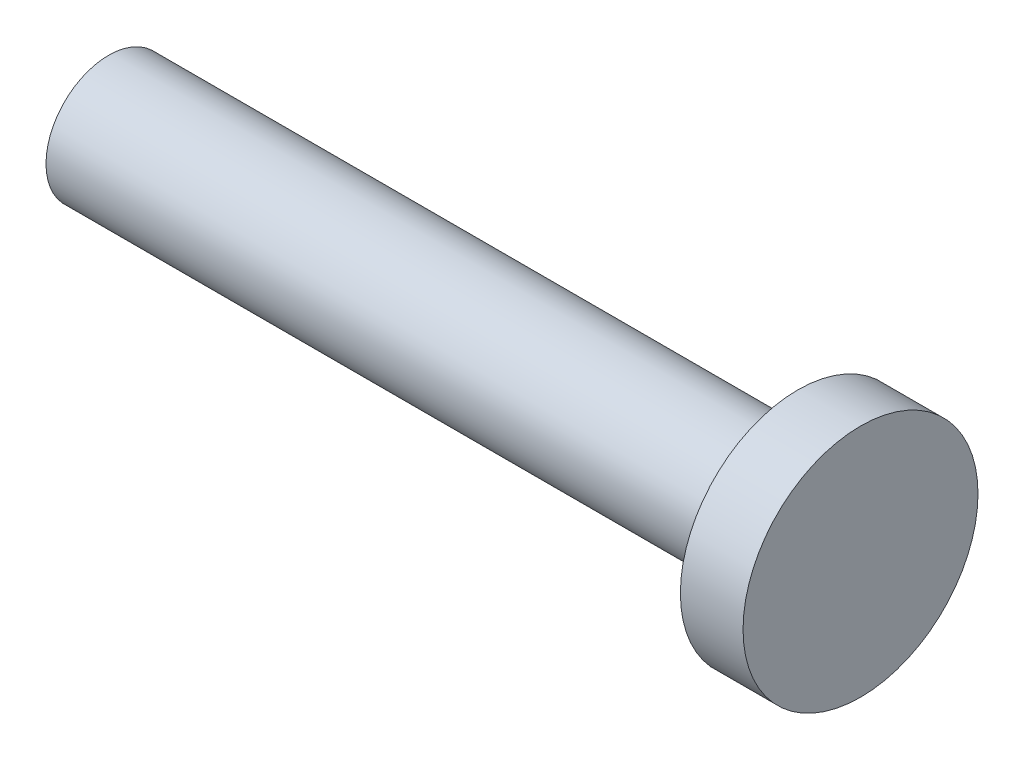
from build123d import *

# Parameters (mm, degrees)
SKETCH1_W           = 11
SKETCH1_H           = 1
SKETCH2_R           = 1.875
BOSS_EXTRUDE1_DEPTH = 1


with BuildPart() as part:
    # Sketch1 → Revolve1 (revolve)
    with BuildSketch(Plane.XY):
        with Locations((-144.727441652, 0.5)):
            Rectangle(SKETCH1_W, SKETCH1_H)
    revolve(axis=Axis((-150.227441652, 0, 0), (1, 0, 0)))

    # Sketch2 → Boss-Extrude1 (add)
    with BuildSketch(Plane(origin=(-139.227441652, 0, 0), x_dir=(0, 0, -1), z_dir=(1, 0, 0))):
        Circle(SKETCH2_R)
    extrude(amount=BOSS_EXTRUDE1_DEPTH)


solid = part.part
